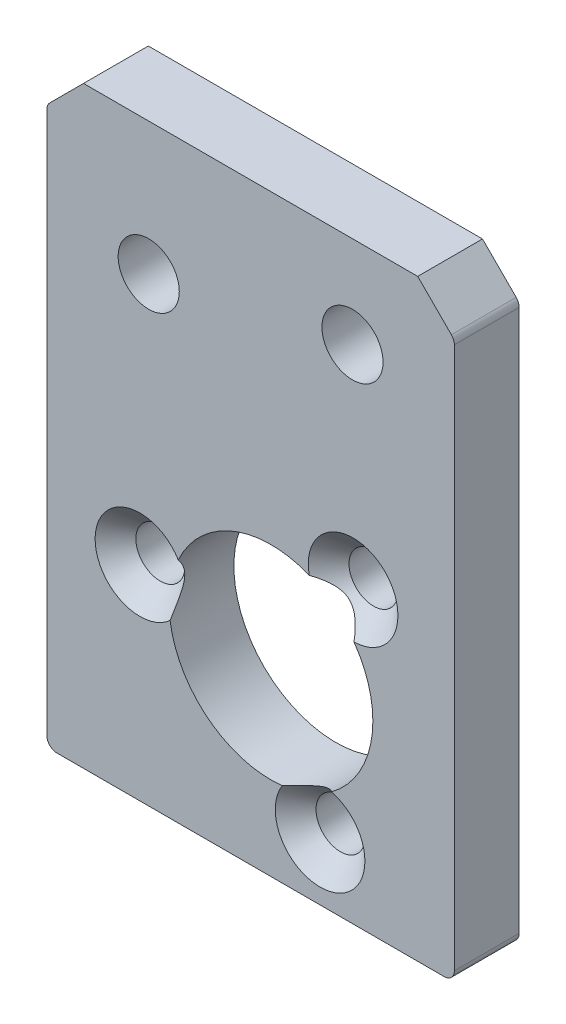
from build123d import *

# Parameters (mm, degrees)
SKETCH1_W                                       = 20
SKETCH1_H                                       = 29.11
SKETCH1_R                                       = 5
SKETCH1_R_2                                     = 1.5
SKETCH1_R_3                                     = 1.2
BOSS_EXTRUDE2_DEPTH                             = 3.18
CSK_FOR_M2_FLAT_HEAD_MACHINE_SCREW1_D           = 2.4
CSK_FOR_M2_FLAT_HEAD_MACHINE_SCREW1_DEPTH       = 3.508967257
CSK_FOR_M2_FLAT_HEAD_MACHINE_SCREW1_CSINK_D     = 4.4
CSK_FOR_M2_FLAT_HEAD_MACHINE_SCREW1_CSINK_ANGLE = 90
CSK_FOR_M2_FLAT_HEAD_MACHINE_SCREW1_TIP         = 0.721032743
CHAMFER1_SIZE                                   = 1.8
FILLET3_R                                       = 0.5


with BuildPart() as part:
    # Sketch1 → Boss-Extrude2 (new body)
    with BuildSketch(Plane.XY):
        with Locations((10, 14.555)):
            Rectangle(SKETCH1_W, SKETCH1_H)
        with Locations((11, 9.11)):
            Circle(SKETCH1_R, mode=Mode.SUBTRACT)
        with Locations((5, 22.61)):
            Circle(SKETCH1_R_2, mode=Mode.SUBTRACT)
        with Locations((15, 24.61)):
            Circle(SKETCH1_R_2, mode=Mode.SUBTRACT)
        with Locations((15.03, 14.21)):
            Circle(SKETCH1_R_3, mode=Mode.SUBTRACT)
        with Locations((4.57, 10.04)):
            Circle(SKETCH1_R_3, mode=Mode.SUBTRACT)
        with Locations((13.41, 2.96)):
            Circle(SKETCH1_R_3, mode=Mode.SUBTRACT)
    extrude(amount=-BOSS_EXTRUDE2_DEPTH)

    # CSK for M2 Flat Head Machine Screw1
    with Locations(Plane.XY):
        with Locations((4.57, 10.04), (15.03, 14.21), (13.41, 2.96)):
            CounterSinkHole(CSK_FOR_M2_FLAT_HEAD_MACHINE_SCREW1_D / 2, CSK_FOR_M2_FLAT_HEAD_MACHINE_SCREW1_CSINK_D / 2, depth=CSK_FOR_M2_FLAT_HEAD_MACHINE_SCREW1_DEPTH, counter_sink_angle=CSK_FOR_M2_FLAT_HEAD_MACHINE_SCREW1_CSINK_ANGLE)
            with Locations((0, 0, -(CSK_FOR_M2_FLAT_HEAD_MACHINE_SCREW1_DEPTH + CSK_FOR_M2_FLAT_HEAD_MACHINE_SCREW1_TIP / 2))):  # 118° drill point
                Cone(0, CSK_FOR_M2_FLAT_HEAD_MACHINE_SCREW1_D / 2, CSK_FOR_M2_FLAT_HEAD_MACHINE_SCREW1_TIP, mode=Mode.SUBTRACT)

    # Chamfer1
    chamfer1_edges = [part.edges().sort_by_distance(p)[0] for p in [
        (0, 29.11, -1.59),
        (20, 29.11, -1.59),
    ]]
    chamfer(chamfer1_edges, length=CHAMFER1_SIZE)

    # Fillet3
    fillet3_edges = [part.edges().sort_by_distance(p)[0] for p in [
        (20, 0, -1.59),
        (0, 0, -1.59),
        (0, 27.31, -1.59),
        (20, 27.31, -1.59),
    ]]
    fillet(fillet3_edges, radius=FILLET3_R)


solid = part.part
